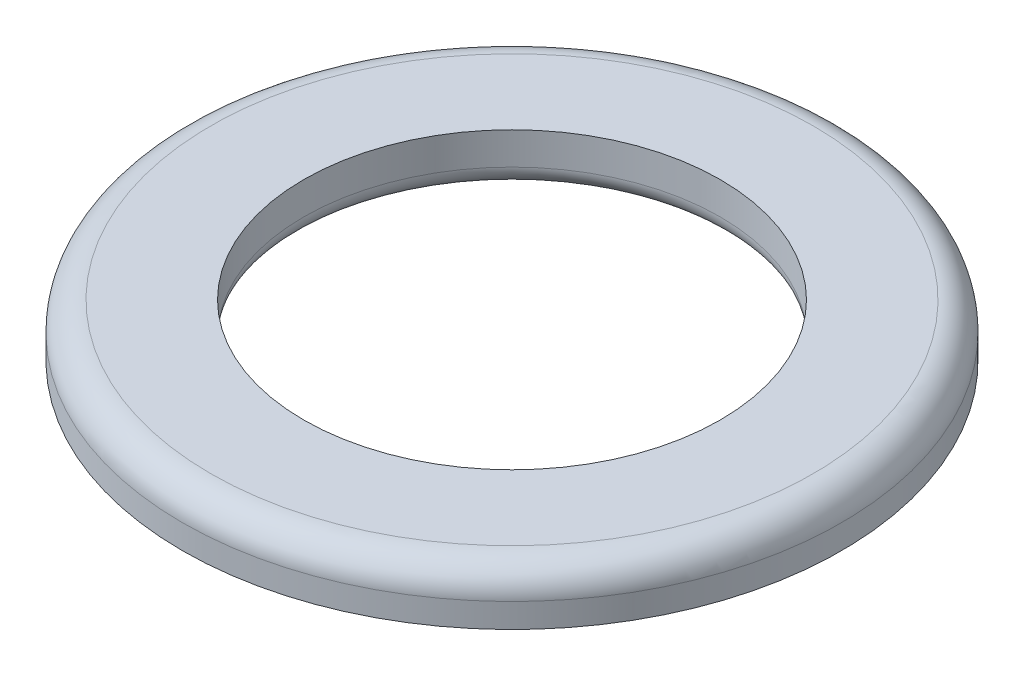
from build123d import *

# Parameters (mm, degrees)
SKETCH1_R           = 8.15
SKETCH1_R_2         = 5.15
BOSS_EXTRUDE1_DEPTH = 1.3
FILLET3_R           = 0.7
FILLET4_R           = 0.5


with BuildPart() as part:
    # Sketch1 → Boss-Extrude1 (new body)
    with BuildSketch(Plane(origin=(0, 0, 0), x_dir=(1, 0, 0), z_dir=(0, 1, 0))):
        Circle(SKETCH1_R)
        Circle(SKETCH1_R_2, mode=Mode.SUBTRACT)
    extrude(amount=BOSS_EXTRUDE1_DEPTH)

    # Fillet3
    fillet3_edges = [part.edges().sort_by_distance(p)[0] for p in [
        (-8.15, 1.3, 0),
    ]]
    fillet(fillet3_edges, radius=FILLET3_R)

    # Fillet4
    fillet4_edges = [part.edges().sort_by_distance(p)[0] for p in [
        (-5.15, 0, 0),
    ]]
    fillet(fillet4_edges, radius=FILLET4_R)


solid = part.part
